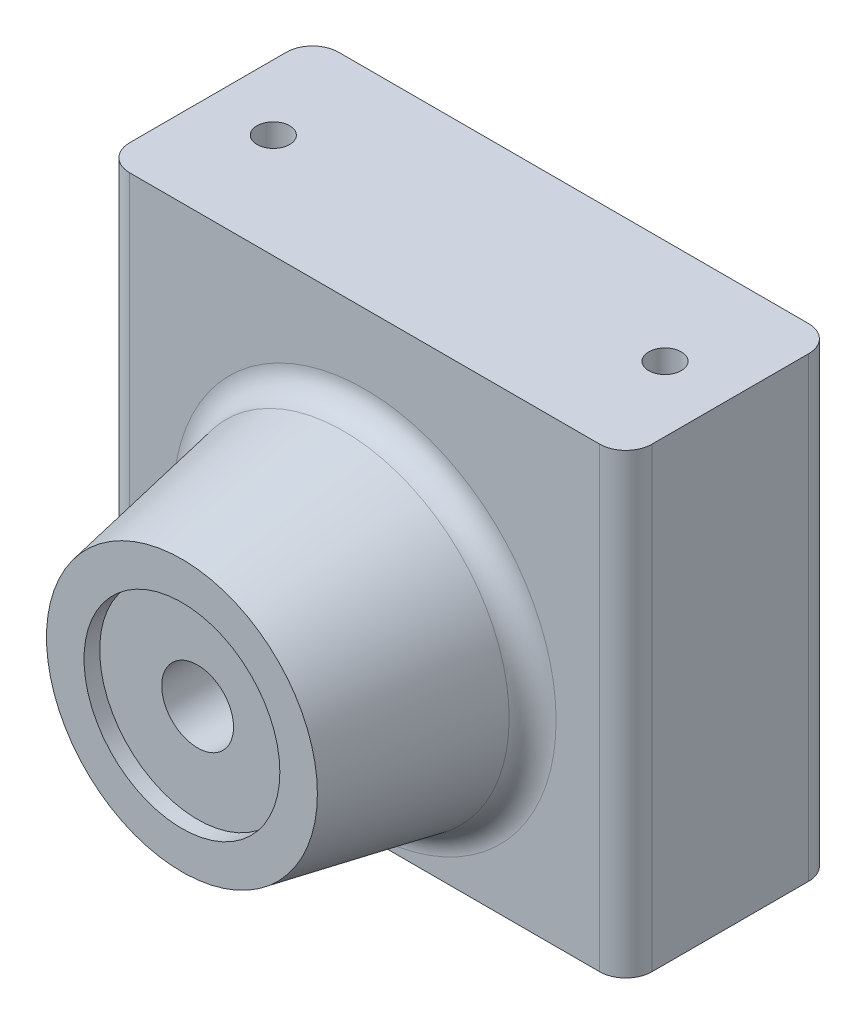
from build123d import *

# Parameters (mm, degrees)
SKETCH_1_W             = 40
SKETCH_1_H             = 35
EXTRUDE_457_DEPTH      = 16
SKETCH_2_R             = 10
EXTRUDE_593_DEPTH      = 14
SKETCH_4_R             = 2.75
CUT_EXTRUDE_684_DEPTH  = 42.231056256
CHAMFER_2_SIZE         = 3
CHAMFER_2_SIZE_2       = 16
FILLET_5_R             = 2
SKETCH_7_R             = 1.25
CUT_EXTRUDE_1001_DEPTH = 44.370496884
FILLET_7_R             = 2
SKETCH_8_R             = 7.5
CUT_EXTRUDE_1355_DEPTH = 1.2
CUT_EXTRUDE_START      = -1.5
SKETCH_9_R             = 7.5
CUT_EXTRUDE_1489_DEPTH = 1.5


with BuildPart() as part:
    # Эскиз1 → Extrude 457 (new body)
    with BuildSketch(Plane.XY):
        with Locations((0, 2.5)):
            Rectangle(SKETCH_1_W, SKETCH_1_H)
    extrude(amount=-EXTRUDE_457_DEPTH)

    # Эскиз2 → Extrude 593 (add)
    with BuildSketch(Plane.XY):
        Circle(SKETCH_2_R)
    extrude(amount=EXTRUDE_593_DEPTH)

    # Эскиз4 → Cut-Extrude 684 (cut, through all)
    with BuildSketch(Plane.XY.offset(14)):
        Circle(SKETCH_4_R)
    extrude(amount=-CUT_EXTRUDE_684_DEPTH, mode=Mode.SUBTRACT)

    # Фаска2
    # the kernel refuses this chamfer: 16, 3 mm, written as the material it adds along each edge
    with BuildSketch(Plane(origin=(0, 0, 0), x_dir=(1, 0, 0), z_dir=(0, -1, 0))) as chamfer_2_piece_1_section:
        Polygon((10 + CHAMFER_2_SIZE, 0), (10, CHAMFER_2_SIZE_2), (10, 0), align=None)
    chamfer_2_piece_1 = revolve(axis=Axis((0, 0, 0), (0, 0, 1)), mode=Mode.PRIVATE)
    chamfer_2_piece_1 = split(chamfer_2_piece_1, bisect_by=Plane(origin=(-11.622307858, 0, 14), z_dir=(0, 0, -1)), keep=Keep.TOP, mode=Mode.PRIVATE)
    add(chamfer_2_piece_1)

    # Скругление5
    fillet_5_edges = [part.edges().sort_by_distance(p)[0] for p in [
        (-13, 0, 0),
    ]]
    fillet(fillet_5_edges, radius=FILLET_5_R)

    # Эскиз7 → Cut-Extrude 1001 (cut, through all)
    with BuildSketch(Plane(origin=(0, 20, 0), x_dir=(1, 0, 0), z_dir=(0, 1, 0))):
        with Locations(Location((-15, 8, 0), (0, 0, 180))):
            Circle(SKETCH_7_R)
        with Locations(Location((15, 8, 0), (0, 0, 180))):
            Circle(SKETCH_7_R)
    extrude(amount=-CUT_EXTRUDE_1001_DEPTH, mode=Mode.SUBTRACT)

    # Скругление7
    fillet_7_edges = [part.edges().sort_by_distance(p)[0] for p in [
        (20, 2.5, -16),
        (-20, 2.5, -16),
        (20, 2.5, 0),
        (-20, 2.5, 0),
    ]]
    fillet(fillet_7_edges, radius=FILLET_7_R)

    # Эскиз8 → Cut-Extrude 1355 (cut)
    with BuildSketch(Plane.XY.offset(14)):
        Circle(SKETCH_8_R)
    extrude(amount=-CUT_EXTRUDE_1355_DEPTH, mode=Mode.SUBTRACT)

    # Эскиз9 → Cut-Extrude 1489 (cut)
    with BuildSketch(Plane(origin=(0, 0, -16), x_dir=(-1, 0, 0), z_dir=(0, 0, -1)).offset(CUT_EXTRUDE_START)):
        with Locations(Location((0, 0, 0), (0, 0, 180))):
            Circle(SKETCH_9_R)
    extrude(amount=CUT_EXTRUDE_1489_DEPTH, mode=Mode.SUBTRACT)


solid = part.part
